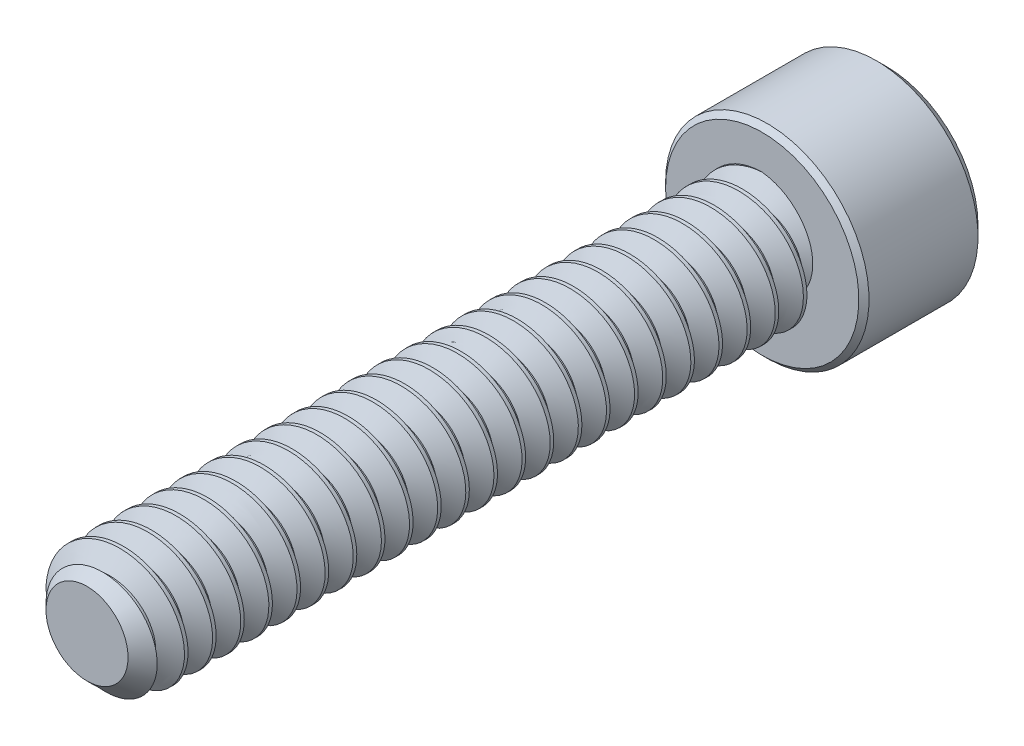
from build123d import *

# Parameters (mm, degrees)
SKETCH1_R          = 1.7526
EXTRUDE1_DEPTH     = 19.05
CHAMFER3_SIZE      = 0.5953125
CUT_SWEEP1_PITCH   = 0.79375
SKETCH6_R          = 2.8702
EXTRUDE2_DEPTH     = 3.5052
CUT_EXTRUDE1_DEPTH = 2.08359375
CHAMFER1_SIZE      = 0.28702
CHAMFER2_SIZE      = 0.14351


with BuildPart() as part:
    # Sketch1 → Extrude1 (new body)
    with BuildSketch(Plane.XY):
        Circle(SKETCH1_R)
    extrude(amount=-EXTRUDE1_DEPTH)

    # Chamfer3
    chamfer3_edges = [part.edges().sort_by_distance(p)[0] for p in [
        (-1.7526, 0, 0),
    ]]
    chamfer(chamfer3_edges, length=CHAMFER3_SIZE)

    # Cut-Sweep1: arcs per turn and ends read off the stored shape
    # Cut-Sweep1: the profile of Sketch3 profile screwed along a right-hand helix through 26 turns, 6 arcs to a turn; built about Z, then put on its axis
    cut_sweep1_z = Axis((0, 0, 0), (0, 0, 1))
    cut_sweep1_corners = [(1.7529, 0, -0.694704455), (1.237044252, 0, -0.396875), (1.237044252, 0, -0.29765625), (1.7529, 0, 0.000173205)]
    with BuildLine(mode=Mode.PRIVATE) as cut_sweep1_profile:
        Line(cut_sweep1_corners[0], cut_sweep1_corners[1])
        Line(cut_sweep1_corners[1], cut_sweep1_corners[2])
        Line(cut_sweep1_corners[2], cut_sweep1_corners[3])
        Line(cut_sweep1_corners[3], cut_sweep1_corners[0])
    cut_sweep1_cap = Face(cut_sweep1_profile.wire())
    cut_sweep1_turn_angles = [0, 30, 60, 90, 120, 150, 180, 210, 240, 270, 300, 330, 360]
    cut_sweep1_turn_weights = [1, 0.8660254037844387, 1, 0.8660254037844387, 1, 0.8660254037844387, 1, 0.8660254037844387, 1, 0.8660254037844387, 1, 0.8660254037844387, 1]
    cut_sweep1_turn_rails = [Edge.make_bspline([Vector(p[0], p[1], 0).rotate(cut_sweep1_z, cut_sweep1_turn_angles[k]) / cut_sweep1_turn_weights[k] + Vector(0, 0, p[2] + CUT_SWEEP1_PITCH * cut_sweep1_turn_angles[k] / 360) for k in range(13)], [0, 0, 0, 1, 1, 2, 2, 3, 3, 4, 4, 5, 5, 6, 6, 6], 2, cut_sweep1_turn_weights) for p in cut_sweep1_corners]
    cut_sweep1_turn_sides = [Face.make_surface_from_curves(cut_sweep1_turn_rails[p[0]], cut_sweep1_turn_rails[p[1]]) for p in [(0, 1), (1, 2), (2, 3), (3, 0)]]
    cut_sweep1 = Plane(origin=(0, 0, 0), x_dir=(0, 1, 0), z_dir=(0, 0, -1)) * Solid(Shell([*[p.moved(Location((0, 0, CUT_SWEEP1_PITCH * i))) for i in range(26) for p in cut_sweep1_turn_sides], cut_sweep1_cap, cut_sweep1_cap.rotate(cut_sweep1_z, 9360).moved(Location((0, 0, CUT_SWEEP1_PITCH * 9360 / 360)))]))
    add(cut_sweep1, mode=Mode.SUBTRACT)

    # Sketch6 → Extrude2 (add)
    with BuildSketch(Plane(origin=(0, 0, -19.05), x_dir=(-1, 0, 0), z_dir=(0, 0, -1))):
        Circle(SKETCH6_R)
    extrude(amount=EXTRUDE2_DEPTH)

    # Sketch7 → Cut-Extrude1 (cut)
    with BuildSketch(Plane(origin=(0, 0, -22.5552), x_dir=(-1, 0, 0), z_dir=(0, 0, -1))):
        Polygon((0, 1.603951217), (-1.3890625, 0.801975608), (-1.3890625, -0.801975608), (0, -1.603951217), (1.3890625, -0.801975608), (1.3890625, 0.801975608), align=None)
    extrude(amount=-CUT_EXTRUDE1_DEPTH, mode=Mode.SUBTRACT)

    # Cut-Extrude2 cone 1 section (through the dimple's axis) → Cut-Extrude2 (revolve, cut)
    with BuildSketch(Plane(origin=(0, 0, -22.5552), x_dir=(0, 1, 0), z_dir=(1, 0, 0))):
        Polygon((0, 0), (1.603951217, 0), (0, 1.603951217), align=None)
    revolve(axis=Axis((0, 0, -22.5552), (0, 0, 1)), mode=Mode.SUBTRACT)

    # Chamfer1
    chamfer1_edges = [part.edges().sort_by_distance(p)[0] for p in [
        (2.8702, 0, -22.5552),
    ]]
    chamfer(chamfer1_edges, length=CHAMFER1_SIZE)

    # Chamfer2
    chamfer2_edges = [part.edges().sort_by_distance(p)[0] for p in [
        (2.8702, 0, -19.05),
    ]]
    chamfer(chamfer2_edges, length=CHAMFER2_SIZE)


solid = part.part
